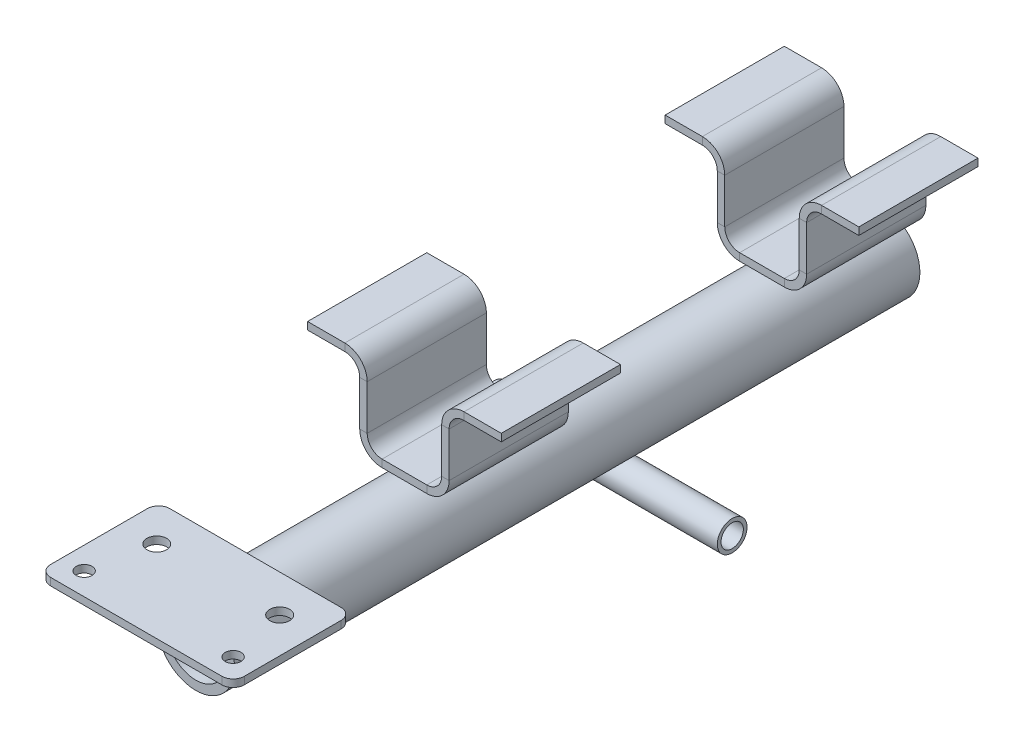
from build123d import *

# Parameters (mm, degrees)
SKETCH1_R                         = 16.51
SKETCH1_R_2                       = 12.7
BOSS_EXTRUDE1_DEPTH               = 292.1
BOSS_EXTRUDE2_START               = 16.51
SKETCH2_W                         = 82.55
SKETCH2_H                         = 50.8
BOSS_EXTRUDE2_DEPTH               = 3.175
SKETCH2_W_2                       = 38.1
BOSS_EXTRUDE2_2_DEPTH             = 3.175
FILLET1_R                         = 4.7625
SKETCH4_W                         = 3.3782
SKETCH4_H                         = 36.195
F_1_4_CLEARANCE_HOLE1_AT_2_COUNT  = 2
F_1_4_CLEARANCE_HOLE1_AT_2_PITCH  = 63.5
SKETCH18_W                        = 4.2164
SKETCH18_H                        = 36.195
F_5_16_CLEARANCE_HOLE1_AT_2_COUNT = 2
F_5_16_CLEARANCE_HOLE1_AT_2_PITCH = 52.3875
SKETCH16_R                        = 6.35
SKETCH16_R_2                      = 4.7625
BOSS_EXTRUDE3_DEPTH               = 50.8
EDGE_FLANGE1_STRIP_W              = 25.4
EDGE_FLANGE1_STRIP_H              = 3.175
EDGE_FLANGE1_STRIP_CUT_DEPTH      = 50.8
EDGE_FLANGE1_STRIP_2_W            = 25.4
EDGE_FLANGE1_STRIP_2_H            = 3.175
EDGE_FLANGE1_STRIP_CUT_2_DEPTH    = 50.8
EDGE_FLANGE1_DEPTH                = 50.8
EDGE_FLANGE1_BEND_DEPTH           = 50.8
EDGE_FLANGE3_STRIP_W              = 25.4
EDGE_FLANGE3_STRIP_H              = 3.175
EDGE_FLANGE3_STRIP_CUT_DEPTH      = 50.8
EDGE_FLANGE3_STRIP_2_W            = 25.4
EDGE_FLANGE3_STRIP_2_H            = 3.175
EDGE_FLANGE3_STRIP_CUT_2_DEPTH    = 50.8
EDGE_FLANGE3_DEPTH                = 50.8
EDGE_FLANGE3_BEND_DEPTH           = 50.8
LPATTERN1_COUNT                   = 2
LPATTERN1_PITCH                   = 152.4


# Sheet-metal steps are written as plain solids
with BuildPart() as part:
    # Sketch1 → Boss-Extrude1 (new body)
    with BuildSketch(Plane.XY):
        Circle(SKETCH1_R)
        Circle(SKETCH1_R_2, mode=Mode.SUBTRACT)
    extrude(amount=-BOSS_EXTRUDE1_DEPTH)


with BuildPart() as body_2:
    # Sketch2 → Boss-Extrude2 (new body)
    with BuildSketch(Plane(origin=(0, 0, 0), x_dir=(1, 0, 0), z_dir=(0, 1, 0)).offset(BOSS_EXTRUDE2_START)):
        Rectangle(SKETCH2_W, SKETCH2_H)
    extrude(amount=BOSS_EXTRUDE2_DEPTH)

    # Fillet1
    fillet1_edges = [body_2.edges().sort_by_distance(p)[0] for p in [
        (-41.275, 18.0975, -25.4),
        (41.275, 18.0975, -25.4),
        (41.275, 18.0975, 25.4),
        (-41.275, 18.0975, 25.4),
    ]]
    fillet(fillet1_edges, radius=FILLET1_R)

    # Sketch4 → 1/4 Clearance Hole1 (revolve, cut)
    with BuildSketch(Plane(origin=(-31.75, 19.685, 15.875), x_dir=(0, 0, 1), z_dir=(1, 0, 0))):
        with Locations((1.6891, 18.0975)):
            Rectangle(SKETCH4_W, SKETCH4_H)
    f_1_4_clearance_hole1 = revolve(axis=Axis((-31.75, 26.035, 15.875), (0, -1, 0)), mode=Mode.SUBTRACT)

    # 1/4 Clearance Hole1 at 2: 1/4 Clearance Hole1 ×2
    with Locations(*[(i * F_1_4_CLEARANCE_HOLE1_AT_2_PITCH, 0, 0) for i in range(1, F_1_4_CLEARANCE_HOLE1_AT_2_COUNT)]):
        add(f_1_4_clearance_hole1, mode=Mode.SUBTRACT)

    # Sketch18 → 5/16 Clearance Hole1 (revolve, cut)
    with BuildSketch(Plane(origin=(-26.19375, 19.685, -9.525), x_dir=(0, 0, 1), z_dir=(1, 0, 0))):
        with Locations((2.1082, 18.0975)):
            Rectangle(SKETCH18_W, SKETCH18_H)
    f_5_16_clearance_hole1 = revolve(axis=Axis((-26.19375, 26.035, -9.525), (0, -1, 0)), mode=Mode.SUBTRACT)

    # 5/16 Clearance Hole1 at 2: 5/16 Clearance Hole1 ×2
    with Locations(*[(i * F_5_16_CLEARANCE_HOLE1_AT_2_PITCH, 0, 0) for i in range(1, F_5_16_CLEARANCE_HOLE1_AT_2_COUNT)]):
        add(f_5_16_clearance_hole1, mode=Mode.SUBTRACT)


with BuildPart() as body_3:
    # Sketch2 → Boss-Extrude2 2 (new body)
    with BuildSketch(Plane(origin=(0, 0, 0), x_dir=(1, 0, 0), z_dir=(0, 1, 0)).offset(BOSS_EXTRUDE2_START)):
        with Locations((0, 114.3)):
            Rectangle(SKETCH2_W_2, SKETCH2_H)
    extrude(amount=BOSS_EXTRUDE2_2_DEPTH)

    # Edge-Flange1 strip (across the edge) → Edge-Flange1 strip cut (cut)
    with BuildSketch(Plane(origin=(19.05, 19.685, -88.9), x_dir=(-1, 0, 0), z_dir=(0, 0, -1))):
        with Locations((-3.175, -1.5875)):
            Rectangle(EDGE_FLANGE1_STRIP_W, EDGE_FLANGE1_STRIP_H)
    extrude(amount=EDGE_FLANGE1_STRIP_CUT_DEPTH, mode=Mode.SUBTRACT)

    # Edge-Flange1 strip 2 (across the edge) → Edge-Flange1 strip cut 2 (cut)
    with BuildSketch(Plane(origin=(-19.05, 19.685, -139.7), x_dir=(1, 0, 0), z_dir=(0, 0, 1))):
        with Locations((-3.175, -1.5875)):
            Rectangle(EDGE_FLANGE1_STRIP_2_W, EDGE_FLANGE1_STRIP_2_H)
    extrude(amount=EDGE_FLANGE1_STRIP_CUT_2_DEPTH, mode=Mode.SUBTRACT)

    # Edge-Flange1 section (across the edge) → Edge-Flange1 (add)
    with BuildSketch(Plane(origin=(19.05, 19.685, -88.9), x_dir=(-1, 0, 0), z_dir=(0, 0, -1))):
        with BuildLine():
            Line((0, 6.35), (0, 34.925))
            Line((0, 34.925), (3.175, 34.925))
            Line((3.175, 34.925), (3.175, 6.35))
            ThreePointArc((3.175, 6.35), (5.034871939, 1.859871939), (9.525, 0))
            Line((9.525, 0), (9.525, -3.175))
            ThreePointArc((9.525, -3.175), (2.789807909, -0.385192091), (0, 6.35))
        make_face()
    extrude(amount=EDGE_FLANGE1_DEPTH)

    # Edge-Flange1 section 2 (across the edge) → Edge-Flange1 bend (add)
    with BuildSketch(Plane(origin=(-19.05, 19.685, -139.7), x_dir=(1, 0, 0), z_dir=(0, 0, 1))):
        with BuildLine():
            Line((0, 6.35), (0, 34.925))
            Line((0, 34.925), (3.175, 34.925))
            Line((3.175, 34.925), (3.175, 6.35))
            ThreePointArc((3.175, 6.35), (5.034871939, 1.859871939), (9.525, 0))
            Line((9.525, 0), (9.525, -3.175))
            ThreePointArc((9.525, -3.175), (2.789807909, -0.385192091), (0, 6.35))
        make_face()
    extrude(amount=EDGE_FLANGE1_BEND_DEPTH)

    # Edge-Flange3 strip (across the edge) → Edge-Flange3 strip cut (cut)
    with BuildSketch(Plane(origin=(-19.05, 54.61, -88.9), x_dir=(0, -1, 0), z_dir=(0, 0, -1))):
        with Locations((-3.175, -1.5875)):
            Rectangle(EDGE_FLANGE3_STRIP_W, EDGE_FLANGE3_STRIP_H)
    extrude(amount=EDGE_FLANGE3_STRIP_CUT_DEPTH, mode=Mode.SUBTRACT)

    # Edge-Flange3 strip 2 (across the edge) → Edge-Flange3 strip cut 2 (cut)
    with BuildSketch(Plane(origin=(19.05, 54.61, -139.7), x_dir=(0, -1, 0), z_dir=(0, 0, 1))):
        with Locations((-3.175, -1.5875)):
            Rectangle(EDGE_FLANGE3_STRIP_2_W, EDGE_FLANGE3_STRIP_2_H)
    extrude(amount=EDGE_FLANGE3_STRIP_CUT_2_DEPTH, mode=Mode.SUBTRACT)

    # Edge-Flange3 section (across the edge) → Edge-Flange3 (add)
    with BuildSketch(Plane(origin=(-19.05, 54.61, -88.9), x_dir=(0, -1, 0), z_dir=(0, 0, -1))):
        with BuildLine():
            Line((0, 6.35), (0, 22.225))
            Line((0, 22.225), (3.175, 22.225))
            Line((3.175, 22.225), (3.175, 6.35))
            ThreePointArc((3.175, 6.35), (5.034871939, 1.859871939), (9.525, 0))
            Line((9.525, 0), (9.525, -3.175))
            ThreePointArc((9.525, -3.175), (2.789807909, -0.385192091), (0, 6.35))
        make_face()
    extrude(amount=EDGE_FLANGE3_DEPTH)

    # Edge-Flange3 section 2 (across the edge) → Edge-Flange3 bend (add)
    with BuildSketch(Plane(origin=(19.05, 54.61, -139.7), x_dir=(0, -1, 0), z_dir=(0, 0, 1))):
        with BuildLine():
            Line((0, 6.35), (0, 22.225))
            Line((0, 22.225), (3.175, 22.225))
            Line((3.175, 22.225), (3.175, 6.35))
            ThreePointArc((3.175, 6.35), (5.034871939, 1.859871939), (9.525, 0))
            Line((9.525, 0), (9.525, -3.175))
            ThreePointArc((9.525, -3.175), (2.789807909, -0.385192091), (0, 6.35))
        make_face()
    extrude(amount=EDGE_FLANGE3_BEND_DEPTH)


with BuildPart() as body_4:
    # Sketch16 → Boss-Extrude3 (new, symmetric)
    with BuildSketch(Plane(origin=(0, 0, 0), x_dir=(0, 0, -1), z_dir=(1, 0, 0))):
        with Locations((177.8, -22.86)):
            Circle(SKETCH16_R)
        with Locations((177.8, -22.86)):
            Circle(SKETCH16_R_2, mode=Mode.SUBTRACT)
    extrude(amount=BOSS_EXTRUDE3_DEPTH, both=True)


with BuildPart() as lpattern1_1:
    # LPattern1: pattern copy
    add(body_3.part.moved(Location(Vector(0, 0, -1) * (1 * LPATTERN1_PITCH))))


solid = Compound([part.part, body_2.part, body_3.part, body_4.part, lpattern1_1.part])
